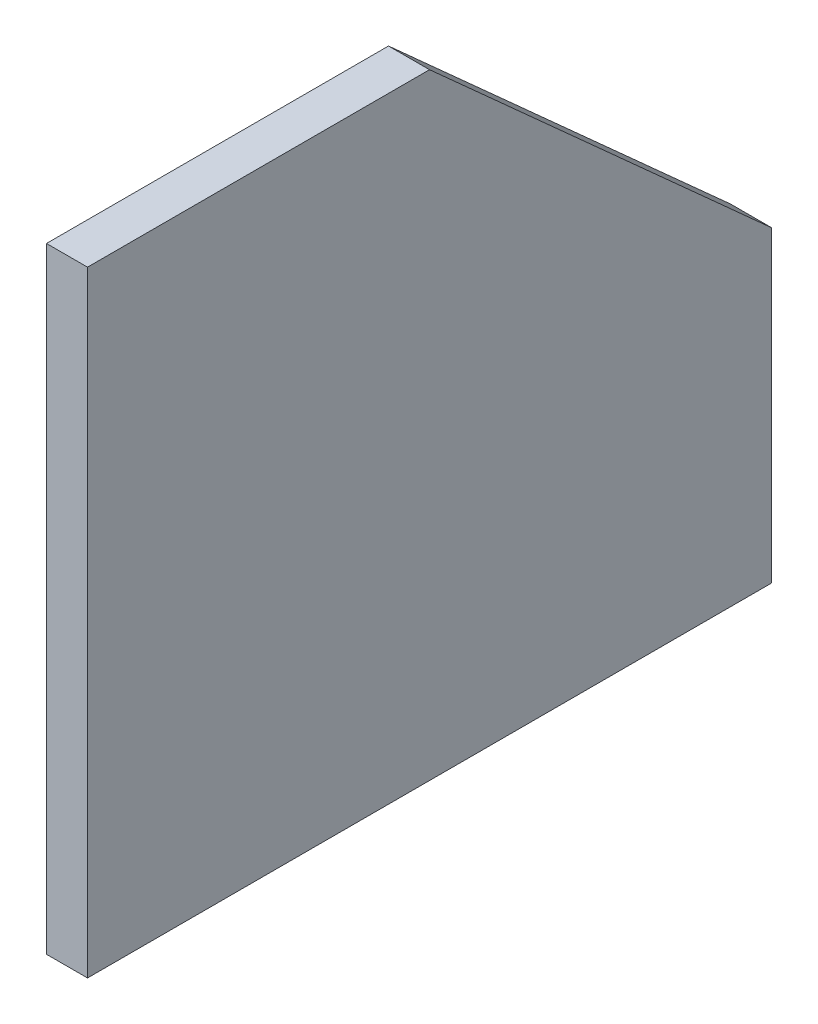
from build123d import *

# Parameters (mm, degrees)
SM_BASE_FLANGE_1_DEPTH = 6


# Sheet-metal steps are written as plain solids
with BuildPart() as part:
    # Sketch 1 → Базовая кромка1 (new body)
    with BuildSketch(Plane(origin=(0, 0, 0), x_dir=(0, 0, -1), z_dir=(1, 0, 0))):
        Polygon((-50, 90), (0, 45), (0, 0), (-100, 0), (-100, 90), align=None)
    extrude(amount=-SM_BASE_FLANGE_1_DEPTH)


solid = part.part
